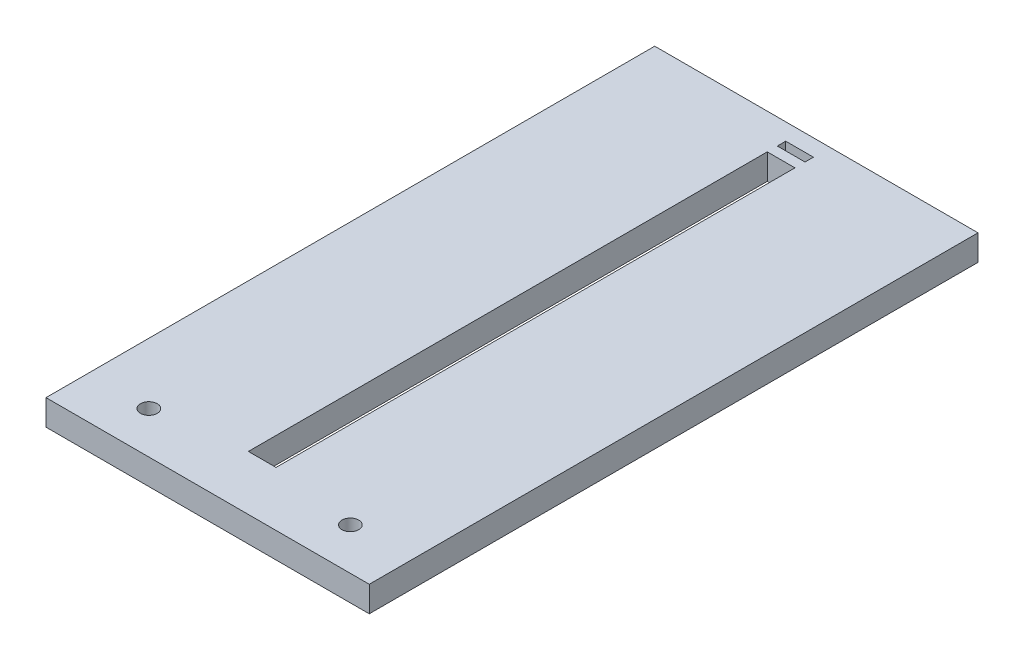
from build123d import *

# Parameters (mm, degrees)
SKETCH1_W           = 38.5
SKETCH1_H           = 72.5
BOSS_EXTRUDE1_DEPTH = 3.05
SKETCH4_W           = 3.3
SKETCH4_H           = 1
SKETCH4_H_2         = 61.8
CUT_EXTRUDE1_DEPTH  = 76.074063431
SKETCH7_R           = 1
CUT_EXTRUDE4_DEPTH  = 76.074063431


with BuildPart() as part:
    # Sketch1 → Boss-Extrude1 (new body)
    with BuildSketch(Plane(origin=(0, 0, 0), x_dir=(1, 0, 0), z_dir=(0, 1, 0))):
        with Locations((0, 36.25)):
            Rectangle(SKETCH1_W, SKETCH1_H)
    extrude(amount=BOSS_EXTRUDE1_DEPTH)

    # Sketch4 → Cut-Extrude1 (cut, through all)
    with BuildSketch(Plane(origin=(0, 3.05, 0), x_dir=(1, 0, 0), z_dir=(0, 1, 0))):
        with Locations((0, 70)):
            Rectangle(SKETCH4_W, SKETCH4_H)
        with Locations((0, 37.4)):
            Rectangle(SKETCH4_W, SKETCH4_H_2)
    extrude(amount=-CUT_EXTRUDE1_DEPTH, mode=Mode.SUBTRACT)

    # Sketch7 → Cut-Extrude4 (cut, through all)
    with BuildSketch(Plane(origin=(0, 3.05, 0), x_dir=(1, 0, 0), z_dir=(0, 1, 0))):
        with Locations((-12, 5)):
            Circle(SKETCH7_R)
        with Locations((12, 5)):
            Circle(SKETCH7_R)
    extrude(amount=-CUT_EXTRUDE4_DEPTH, mode=Mode.SUBTRACT)


solid = part.part
